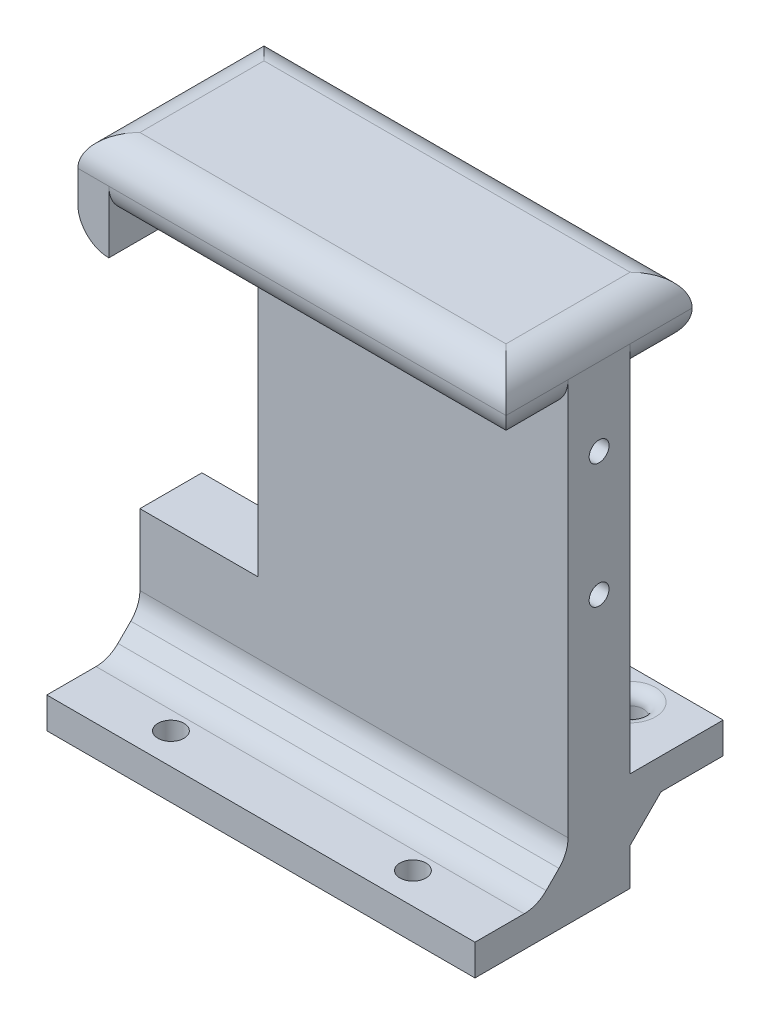
from build123d import *

# Parameters (mm, degrees)
BOSS_EXTRU_1_DEPTH      = 10
BOSS_EXTRU_2_DEPTH      = 10
BOSS_EXTRU_2_DEPTH_BACK = 20
ESQUISSE2_W             = 69
ESQUISSE2_H             = 10
ESQUISSE4_W             = 19
ESQUISSE4_H             = 23.50582434
ESQUISSE4_R             = 4.1
BOSS_EXTRU_3_DEPTH      = 10
ESQUISSE5_W             = 5
ESQUISSE5_H             = 30
BOSS_EXTRU_4_DEPTH      = 5
ESQUISSE6_W             = 69
ESQUISSE6_H             = 5
BOSS_EXTRU_5_DEPTH      = 15
ESQUISSE7_R             = 5.448918283
BOSS_EXTRU_6_DEPTH      = 5
CHANFREIN2_SIZE         = 5
ESQUISSE8_R             = 2.1
ENL_V_MAT_EXTRU_1_DEPTH = 5
ESQUISSE9_R             = 1.6
ENL_V_MAT_EXTRU_2_DEPTH = 68
ESQUISSE10_W            = 50
ESQUISSE10_H            = 5
BOSS_EXTRU_7_DEPTH      = 15
CHANFREIN3_SIZE         = 5
ESQUISSE11_R            = 2.1
ENL_V_MAT_EXTRU_3_DEPTH = 10
CONG_1_R                = 2
CONG_2_R                = 5


with BuildPart() as part:
    # Esquisse1 → Boss.-Extru.1 (new body)
    with BuildSketch(Plane.XY):
        Polygon((0, 0), (0, 81), (-69, 81), (-69, 66), (-64, 66), (-64, 71), (-50, 71), (-50, 0), align=None)
    extrude(amount=BOSS_EXTRU_1_DEPTH)

    # Esquisse2 → Boss.-Extru.2 (add, two sides: drawn at the far end of the back side and taken through both)
    with BuildSketch(Plane.XY.offset(10).offset(-BOSS_EXTRU_2_DEPTH_BACK)):
        with Locations((-34.5, 76)):
            Rectangle(ESQUISSE2_W, ESQUISSE2_H)
    extrude(amount=BOSS_EXTRU_2_DEPTH + BOSS_EXTRU_2_DEPTH_BACK)

    # Esquisse4 → Boss.-Extru.3 (add)
    with BuildSketch(Plane.XY.offset(10)):
        with Locations((-59.5, 11.75291217)):
            Rectangle(ESQUISSE4_W, ESQUISSE4_H)
        with Locations((-57, 12)):
            Circle(ESQUISSE4_R, mode=Mode.SUBTRACT)
    extrude(amount=-BOSS_EXTRU_3_DEPTH)

    # Esquisse5 → Boss.-Extru.4 (add)
    with BuildSketch(Plane.XZ.offset(-71)):
        with Locations((-66.5, 5)):
            Rectangle(ESQUISSE5_W, ESQUISSE5_H)
    extrude(amount=BOSS_EXTRU_4_DEPTH)

    # Esquisse6 → Boss.-Extru.5 (add)
    with BuildSketch(Plane.XY.offset(10)):
        with Locations((-34.5, 2.5)):
            Rectangle(ESQUISSE6_W, ESQUISSE6_H)
    extrude(amount=BOSS_EXTRU_5_DEPTH)

    # Esquisse7 → Boss.-Extru.6 (add)
    with BuildSketch(Plane.XY.offset(10)):
        with Locations((-57, 12)):
            Circle(ESQUISSE7_R)
    extrude(amount=-BOSS_EXTRU_6_DEPTH)

    # Chanfrein2
    chanfrein2_edges = [part.edges().sort_by_distance(p)[0] for p in [
        (-34.5, 5, 10),
    ]]
    chamfer(chanfrein2_edges, length=CHANFREIN2_SIZE)

    # Esquisse8 → Enlèv. mat.-Extru.1 (cut)
    with BuildSketch(Plane(origin=(0, 5, 0), x_dir=(1, 0, 0), z_dir=(0, 1, 0))):
        with Locations(Location((-15, -20, 0), (0, 0, 180))):
            Circle(ESQUISSE8_R)
        with Locations(Location((-54, -20, 0), (0, 0, 180))):
            Circle(ESQUISSE8_R)
    extrude(amount=-ENL_V_MAT_EXTRU_1_DEPTH, mode=Mode.SUBTRACT)

    # Esquisse9 → Enlèv. mat.-Extru.2 (cut)
    with BuildSketch(Plane.ZY.offset(50)):
        with Locations(Location((5, 63.50582434, 0), (0, 0, 270))):
            Circle(ESQUISSE9_R)
        with Locations(Location((5, 43.50582434, 0), (0, 0, 270))):
            Circle(ESQUISSE9_R)
    extrude(amount=-ENL_V_MAT_EXTRU_2_DEPTH, mode=Mode.SUBTRACT)

    # Esquisse10 → Boss.-Extru.7 (add)
    with BuildSketch(Plane(origin=(0, 0, 0), x_dir=(-1, 0, 0), z_dir=(0, 0, -1))):
        with Locations((25, 13.5)):
            Rectangle(ESQUISSE10_W, ESQUISSE10_H)
    extrude(amount=BOSS_EXTRU_7_DEPTH)

    # Chanfrein3
    chanfrein3_edges = [part.edges().sort_by_distance(p)[0] for p in [
        (-25, 11, 0),
    ]]
    chamfer(chanfrein3_edges, length=CHANFREIN3_SIZE)

    # Esquisse11 → Enlèv. mat.-Extru.3 (cut)
    with BuildSketch(Plane(origin=(0, 16, 0), x_dir=(1, 0, 0), z_dir=(0, 1, 0))):
        with Locations(Location((-10, 10, 0), (0, 0, 270))):
            Circle(ESQUISSE11_R)
        with Locations(Location((-40, 10, 0), (0, 0, 270))):
            Circle(ESQUISSE11_R)
    extrude(amount=-ENL_V_MAT_EXTRU_3_DEPTH, mode=Mode.SUBTRACT)

    # Congé1
    cong_1_edges = [part.edges().sort_by_distance(p)[0] for p in [
        (-10, 16, -12.1),
        (-40, 16, -12.1),
    ]]
    fillet(cong_1_edges, radius=CONG_1_R)

    # Congé2
    cong_2_edges = [part.edges().sort_by_distance(p)[0] for p in [
        (-34.5, 10, 10),
        (-34.5, 5, 15),
        (-32, 71, -10),
        (0, 71, -5),
        (0, 71, 15),
        (-32, 71, 20),
        (-34.5, 81, 20),
        (-34.5, 81, -10),
        (0, 81, 5),
        (-69, 81, 5),
        (-69, 66, 5),
    ]]
    fillet(cong_2_edges, radius=CONG_2_R - 0.0001)  # a hair under: the kernel refuses the full size


solid = part.part
